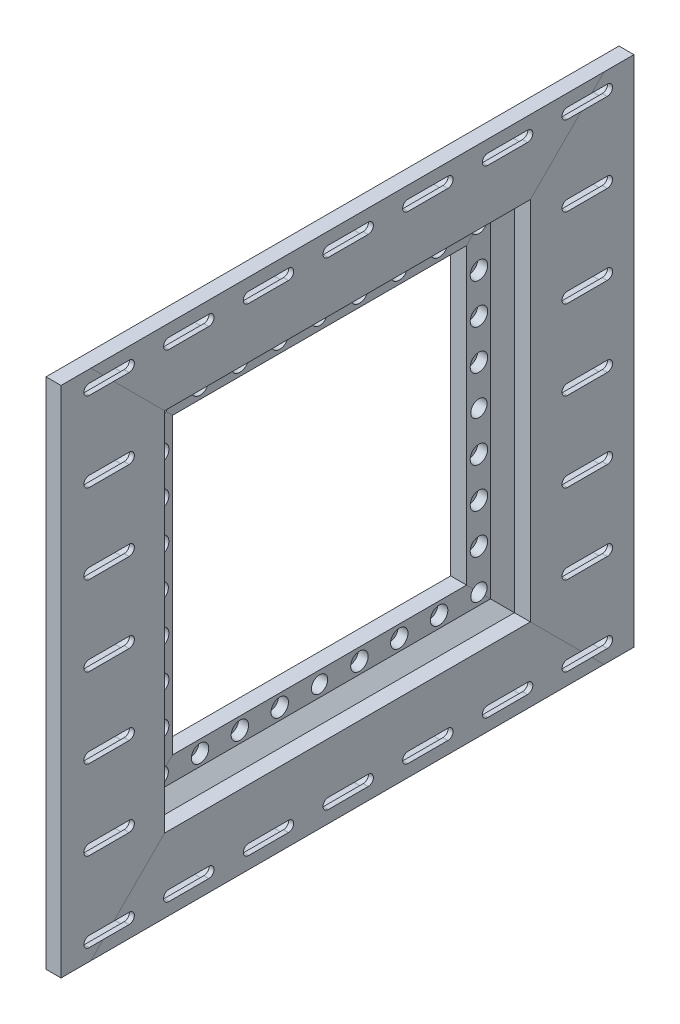
from build123d import *

# Parameters (mm, degrees)
FREE_START                                           = -9.2645
WALL_SCREW_HOLES_R                                   = 3.3782
WALL_SCREW_HOLES_R_2                                 = 5.1945
FREE_FIT_THROUGH_HOLES_DEPTH                         = 10.5345
WALL_SCREWS_CBORE_FOR_1_4_SOCKET_HEAD_CA_D           = 6.7564
WALL_SCREWS_CBORE_FOR_1_4_SOCKET_HEAD_CA_CBORE_D     = 11.1125
WALL_SCREWS_CBORE_FOR_1_4_SOCKET_HEAD_CA_CBORE_DEPTH = 6.35
BOSS_EXTRUDE1_START                                  = 9.525
SKETCH21_W                                           = 19.05
SKETCH21_H                                           = 327.15
BOSS_EXTRUDE1_DEPTH                                  = 9.525
CBORE_START                                          = 9.525
CBORE_SLOT_FOR_1_4_SOCKET_HEAD_CAP_SCREW_DEPTH       = 6.35
CBORE_START_2                                        = 15.875
CBORE_SLOT_FOR_1_4_SOCKET_HEAD_CAP_S_3_DEPTH         = 3.175


# Read off the part's stored shape, not the designer's step: CBORE SLOT for 1/4 Socket Head Cap Screw1
with BuildPart() as part:
    # Frame: sweep along a path in Boundary
    with BuildLine(Plane.ZY) as frame_path:
        Line((0, 0), (-263.65, 0))
        Line((-263.65, 0), (-263.65, 263.65))
        Line((-263.65, 263.65), (0, 263.65))
        Line((0, 263.65), (0, 0))
    # Leg Sketch → Frame (sweep)
    with BuildSketch(Plane.XY):
        Polygon((19.05, 15.24), (8.89, 15.24), (1.27, 22.86), (1.27, 38.1), (-8.89, 38.1), (-8.89, 25.4), (-15.24, 19.05), (-15.24, 15.24), (0, 0), (9.525, 0), (9.525, -31.75), (19.05, -31.75), align=None)
    sweep(path=frame_path.line, transition=Transition.RIGHT)

    # Wall Screw Holes → Free Fit Through Holes (cut)
    with BuildSketch(Plane(origin=(0, 0, 0), x_dir=(0, 0, -1), z_dir=(1, 0, 0)).offset(FREE_START)):
        with Locations(Location((30.23, 55.63, 0), (0, 0, 180))):
            Circle(WALL_SCREW_HOLES_R)
        with Locations(Location((55.63, 30.23, 0), (0, 0, 180))):
            Circle(WALL_SCREW_HOLES_R)
        with Locations(Location((30.23, 81.03, 0), (0, 0, 180))):
            Circle(WALL_SCREW_HOLES_R)
        with Locations(Location((30.23, 106.43, 0), (0, 0, 180))):
            Circle(WALL_SCREW_HOLES_R)
        with Locations(Location((30.23, 157.23, 0), (0, 0, 180))):
            Circle(WALL_SCREW_HOLES_R)
        with Locations(Location((30.23, 182.63, 0), (0, 0, 180))):
            Circle(WALL_SCREW_HOLES_R)
        with Locations(Location((30.23, 208.03, 0), (0, 0, 180))):
            Circle(WALL_SCREW_HOLES_R)
        with Locations(Location((55.63, 233.42, 0), (0, 0, 180))):
            Circle(WALL_SCREW_HOLES_R)
        with Locations(Location((81.03, 233.42, 0), (0, 0, 180))):
            Circle(WALL_SCREW_HOLES_R)
        with Locations(Location((81.03, 30.23, 0), (0, 0, 180))):
            Circle(WALL_SCREW_HOLES_R)
        with Locations(Location((106.43, 233.42, 0), (0, 0, 180))):
            Circle(WALL_SCREW_HOLES_R)
        with Locations(Location((106.43, 30.23, 0), (0, 0, 180))):
            Circle(WALL_SCREW_HOLES_R)
        with Locations(Location((157.23, 233.42, 0), (0, 0, 180))):
            Circle(WALL_SCREW_HOLES_R)
        with Locations(Location((157.23, 30.23, 0), (0, 0, 180))):
            Circle(WALL_SCREW_HOLES_R)
        with Locations(Location((182.63, 233.42, 0), (0, 0, 180))):
            Circle(WALL_SCREW_HOLES_R)
        with Locations(Location((182.63, 30.23, 0), (0, 0, 180))):
            Circle(WALL_SCREW_HOLES_R)
        with Locations(Location((208.03, 233.42, 0), (0, 0, 180))):
            Circle(WALL_SCREW_HOLES_R)
        with Locations(Location((208.03, 30.23, 0), (0, 0, 180))):
            Circle(WALL_SCREW_HOLES_R)
        with Locations(Location((233.42, 81.03, 0), (0, 0, 180))):
            Circle(WALL_SCREW_HOLES_R)
        with Locations(Location((233.42, 55.63, 0), (0, 0, 180))):
            Circle(WALL_SCREW_HOLES_R)
        with Locations(Location((233.42, 106.43, 0), (0, 0, 180))):
            Circle(WALL_SCREW_HOLES_R)
        with Locations(Location((233.42, 157.23, 0), (0, 0, 180))):
            Circle(WALL_SCREW_HOLES_R)
        with Locations(Location((233.42, 182.63, 0), (0, 0, 180))):
            Circle(WALL_SCREW_HOLES_R)
        with Locations(Location((233.42, 208.03, 0), (0, 0, 180))):
            Circle(WALL_SCREW_HOLES_R)
        with Locations(Location((30.23, 233.43, 0), (0, 0, 135.077994507))):
            Circle(WALL_SCREW_HOLES_R_2)
        with Locations(Location((233.42, 233.43, 0), (0, 0, 225.077994507))):
            Circle(WALL_SCREW_HOLES_R_2)
        with Locations(Location((233.42, 30.23, 0), (0, 0, 135))):
            Circle(WALL_SCREW_HOLES_R_2)
        with Locations(Location((30.23, 30.23, 0), (0, 0, 225))):
            Circle(WALL_SCREW_HOLES_R_2)
        with Locations(Location((131.825, 233.42, 0), (0, 0, 180))):
            Circle(WALL_SCREW_HOLES_R_2)
        with Locations(Location((233.42, 131.825, 0), (0, 0, 180))):
            Circle(WALL_SCREW_HOLES_R_2)
        with Locations(Location((131.825, 30.23, 0), (0, 0, 180))):
            Circle(WALL_SCREW_HOLES_R_2)
        with Locations(Location((30.23, 131.825, 0), (0, 0, 180))):
            Circle(WALL_SCREW_HOLES_R_2)
    extrude(amount=FREE_FIT_THROUGH_HOLES_DEPTH, mode=Mode.SUBTRACT)

    # Wall Screws CBORE for 1/4 Socket Head Cap Screw1 (through all)
    with Locations(Plane(origin=(1.27, 208.03, -30.23), x_dir=(0, 0, 1), z_dir=(1, 0, 0))):
        with Locations((0, 0), (0, 25.4), (0, 50.8), (0, 101.6), (0, 127), (0, 152.4), (-25.4, 177.8), (-50.8, 177.8), (-177.8, 177.8), (-152.4, 177.8), (-127, 177.8), (-76.2, 177.8), (-203.19, 152.4), (-203.19, 127), (-203.19, 50.8), (-203.19, 25.4), (-203.19, 0), (-177.8, -25.39), (-152.4, -25.39), (-127, -25.39), (-76.2, -25.39), (-50.8, -25.39), (-25.4, -25.39), (-203.19, 101.6)):
            CounterBoreHole(WALL_SCREWS_CBORE_FOR_1_4_SOCKET_HEAD_CA_D / 2, WALL_SCREWS_CBORE_FOR_1_4_SOCKET_HEAD_CA_CBORE_D / 2, WALL_SCREWS_CBORE_FOR_1_4_SOCKET_HEAD_CA_CBORE_DEPTH)

    # Sketch21 → Boss-Extrude1 (add)
    with BuildSketch(Plane(origin=(0, 0, 0), x_dir=(0, 0, -1), z_dir=(1, 0, 0)).offset(BOSS_EXTRUDE1_START)):
        with Locations((304.925, 131.825)):
            Rectangle(SKETCH21_W, SKETCH21_H)
        with Locations((-41.275, 131.825)):
            Rectangle(SKETCH21_W, SKETCH21_H)
    extrude(amount=BOSS_EXTRUDE1_DEPTH)

    # CBORE SLOT for 1_4 Socket Head Cap S 2 → CBORE SLOT for 1/4 Socket Head Cap Screw1 (cut)
    with BuildSketch(Plane.YZ.offset(CBORE_START)):
        with BuildLine():
            ThreePointArc((238.98125, 32.8), (233.425, 38.35625), (227.86875, 32.8))
            Line((227.86875, 32.8), (227.86875, 7.4))
            ThreePointArc((227.86875, 7.4), (233.425, 1.84375), (238.98125, 7.4))
            Line((238.98125, 7.4), (238.98125, 32.8))
        make_face()
        with BuildLine():
            Line((238.98125, -297.4), (238.98125, -272))
            ThreePointArc((238.98125, -272), (233.425, -266.44375), (227.86875, -272))
            Line((227.86875, -272), (227.86875, -297.4))
            ThreePointArc((227.86875, -297.4), (233.425, -302.95625), (238.98125, -297.4))
        make_face()
        with BuildLine():
            ThreePointArc((188.18125, 32.8), (182.625, 38.35625), (177.06875, 32.8))
            Line((177.06875, 32.8), (177.06875, 7.4))
            ThreePointArc((177.06875, 7.4), (182.625, 1.84375), (188.18125, 7.4))
            Line((188.18125, 7.4), (188.18125, 32.8))
        make_face()
        with BuildLine():
            Line((188.18125, -297.4), (188.18125, -272))
            ThreePointArc((188.18125, -272), (182.625, -266.44375), (177.06875, -272))
            Line((177.06875, -272), (177.06875, -297.4))
            ThreePointArc((177.06875, -297.4), (182.625, -302.95625), (188.18125, -297.4))
        make_face()
        with BuildLine():
            ThreePointArc((137.38125, 32.8), (131.825, 38.35625), (126.26875, 32.8))
            Line((126.26875, 32.8), (126.26875, 7.4))
            ThreePointArc((126.26875, 7.4), (131.825, 1.84375), (137.38125, 7.4))
            Line((137.38125, 7.4), (137.38125, 32.8))
        make_face()
        with BuildLine():
            Line((137.38125, -297.4), (137.38125, -272))
            ThreePointArc((137.38125, -272), (131.825, -266.44375), (126.26875, -272))
            Line((126.26875, -272), (126.26875, -297.4))
            ThreePointArc((126.26875, -297.4), (131.825, -302.95625), (137.38125, -297.4))
        make_face()
        with BuildLine():
            ThreePointArc((86.58125, 32.8), (81.025, 38.35625), (75.46875, 32.8))
            Line((75.46875, 32.8), (75.46875, 7.4))
            ThreePointArc((75.46875, 7.4), (81.025, 1.84375), (86.58125, 7.4))
            Line((86.58125, 7.4), (86.58125, 32.8))
        make_face()
        with BuildLine():
            Line((86.58125, -297.4), (86.58125, -272))
            ThreePointArc((86.58125, -272), (81.025, -266.44375), (75.46875, -272))
            Line((75.46875, -272), (75.46875, -297.4))
            ThreePointArc((75.46875, -297.4), (81.025, -302.95625), (86.58125, -297.4))
        make_face()
        with BuildLine():
            ThreePointArc((35.78125, 32.8), (30.225, 38.35625), (24.66875, 32.8))
            Line((24.66875, 32.8), (24.66875, 7.4))
            ThreePointArc((24.66875, 7.4), (30.225, 1.84375), (35.78125, 7.4))
            Line((35.78125, 7.4), (35.78125, 32.8))
        make_face()
        with BuildLine():
            Line((35.78125, -297.4), (35.78125, -272))
            ThreePointArc((35.78125, -272), (30.225, -266.44375), (24.66875, -272))
            Line((24.66875, -272), (24.66875, -297.4))
            ThreePointArc((24.66875, -297.4), (30.225, -302.95625), (35.78125, -297.4))
        make_face()
        with BuildLine():
            ThreePointArc((-15.01875, 32.8), (-20.575, 38.35625), (-26.13125, 32.8))
            Line((-26.13125, 32.8), (-26.13125, 7.4))
            ThreePointArc((-26.13125, 7.4), (-20.575, 1.84375), (-15.01875, 7.4))
            Line((-15.01875, 7.4), (-15.01875, 32.8))
        make_face()
        with BuildLine():
            Line((-15.01875, -43.4), (-15.01875, -18))
            ThreePointArc((-15.01875, -18), (-20.575, -12.44375), (-26.13125, -18))
            Line((-26.13125, -18), (-26.13125, -43.4))
            ThreePointArc((-26.13125, -43.4), (-20.575, -48.95625), (-15.01875, -43.4))
        make_face()
        with BuildLine():
            Line((-15.01875, -94.2), (-15.01875, -68.8))
            ThreePointArc((-15.01875, -68.8), (-20.575, -63.24375), (-26.13125, -68.8))
            Line((-26.13125, -68.8), (-26.13125, -94.2))
            ThreePointArc((-26.13125, -94.2), (-20.575, -99.75625), (-15.01875, -94.2))
        make_face()
        with BuildLine():
            Line((-15.01875, -145), (-15.01875, -119.6))
            ThreePointArc((-15.01875, -119.6), (-20.575, -114.04375), (-26.13125, -119.6))
            Line((-26.13125, -119.6), (-26.13125, -145))
            ThreePointArc((-26.13125, -145), (-20.575, -150.55625), (-15.01875, -145))
        make_face()
        with BuildLine():
            Line((-15.01875, -195.8), (-15.01875, -170.4))
            ThreePointArc((-15.01875, -170.4), (-20.575, -164.84375), (-26.13125, -170.4))
            Line((-26.13125, -170.4), (-26.13125, -195.8))
            ThreePointArc((-26.13125, -195.8), (-20.575, -201.35625), (-15.01875, -195.8))
        make_face()
        with BuildLine():
            Line((-15.01875, -246.6), (-15.01875, -221.2))
            ThreePointArc((-15.01875, -221.2), (-20.575, -215.64375), (-26.13125, -221.2))
            Line((-26.13125, -221.2), (-26.13125, -246.6))
            ThreePointArc((-26.13125, -246.6), (-20.575, -252.15625), (-15.01875, -246.6))
        make_face()
        with BuildLine():
            Line((-15.01875, -297.4), (-15.01875, -272))
            ThreePointArc((-15.01875, -272), (-20.575, -266.44375), (-26.13125, -272))
            Line((-26.13125, -272), (-26.13125, -297.4))
            ThreePointArc((-26.13125, -297.4), (-20.575, -302.95625), (-15.01875, -297.4))
        make_face()
        with BuildLine():
            ThreePointArc((289.78125, -272), (284.225, -266.44375), (278.66875, -272))
            Line((278.66875, -272), (278.66875, -297.4))
            ThreePointArc((278.66875, -297.4), (284.225, -302.95625), (289.78125, -297.4))
            Line((289.78125, -297.4), (289.78125, -272))
        make_face()
        with BuildLine():
            Line((289.78125, -246.6), (289.78125, -221.2))
            ThreePointArc((289.78125, -221.2), (284.225, -215.64375), (278.66875, -221.2))
            Line((278.66875, -221.2), (278.66875, -246.6))
            ThreePointArc((278.66875, -246.6), (284.225, -252.15625), (289.78125, -246.6))
        make_face()
        with BuildLine():
            Line((289.78125, -195.8), (289.78125, -170.4))
            ThreePointArc((289.78125, -170.4), (284.225, -164.84375), (278.66875, -170.4))
            Line((278.66875, -170.4), (278.66875, -195.8))
            ThreePointArc((278.66875, -195.8), (284.225, -201.35625), (289.78125, -195.8))
        make_face()
        with BuildLine():
            Line((289.78125, -145), (289.78125, -119.6))
            ThreePointArc((289.78125, -119.6), (284.225, -114.04375), (278.66875, -119.6))
            Line((278.66875, -119.6), (278.66875, -145))
            ThreePointArc((278.66875, -145), (284.225, -150.55625), (289.78125, -145))
        make_face()
        with BuildLine():
            Line((289.78125, -94.2), (289.78125, -68.8))
            ThreePointArc((289.78125, -68.8), (284.225, -63.24375), (278.66875, -68.8))
            Line((278.66875, -68.8), (278.66875, -94.2))
            ThreePointArc((278.66875, -94.2), (284.225, -99.75625), (289.78125, -94.2))
        make_face()
        with BuildLine():
            Line((289.78125, -43.4), (289.78125, -18))
            ThreePointArc((289.78125, -18), (284.225, -12.44375), (278.66875, -18))
            Line((278.66875, -18), (278.66875, -43.4))
            ThreePointArc((278.66875, -43.4), (284.225, -48.95625), (289.78125, -43.4))
        make_face()
        with BuildLine():
            Line((289.78125, 7.4), (289.78125, 32.8))
            ThreePointArc((289.78125, 32.8), (284.225, 38.35625), (278.66875, 32.8))
            Line((278.66875, 32.8), (278.66875, 7.4))
            ThreePointArc((278.66875, 7.4), (284.225, 1.84375), (289.78125, 7.4))
        make_face()
    extrude(amount=CBORE_SLOT_FOR_1_4_SOCKET_HEAD_CAP_SCREW_DEPTH, mode=Mode.SUBTRACT)

    # CBORE SLOT for 1_4 Socket Head Cap S 3 o → CBORE SLOT for 1_4 Socket Head Cap S 3 (cut)
    with BuildSketch(Plane.YZ.offset(CBORE_START_2)):
        with BuildLine():
            ThreePointArc((236.8032, 32.8), (233.425, 36.1782), (230.0468, 32.8))
            Line((230.0468, 32.8), (230.0468, 7.4))
            ThreePointArc((230.0468, 7.4), (233.425, 4.0218), (236.8032, 7.4))
            Line((236.8032, 7.4), (236.8032, 32.8))
        make_face()
        with BuildLine():
            Line((236.8032, -297.4), (236.8032, -272))
            ThreePointArc((236.8032, -272), (233.425, -268.6218), (230.0468, -272))
            Line((230.0468, -272), (230.0468, -297.4))
            ThreePointArc((230.0468, -297.4), (233.425, -300.7782), (236.8032, -297.4))
        make_face()
        with BuildLine():
            ThreePointArc((186.0032, 32.8), (182.625, 36.1782), (179.2468, 32.8))
            Line((179.2468, 32.8), (179.2468, 7.4))
            ThreePointArc((179.2468, 7.4), (182.625, 4.0218), (186.0032, 7.4))
            Line((186.0032, 7.4), (186.0032, 32.8))
        make_face()
        with BuildLine():
            Line((186.0032, -297.4), (186.0032, -272))
            ThreePointArc((186.0032, -272), (182.625, -268.6218), (179.2468, -272))
            Line((179.2468, -272), (179.2468, -297.4))
            ThreePointArc((179.2468, -297.4), (182.625, -300.7782), (186.0032, -297.4))
        make_face()
        with BuildLine():
            ThreePointArc((135.2032, 32.8), (131.825, 36.1782), (128.4468, 32.8))
            Line((128.4468, 32.8), (128.4468, 7.4))
            ThreePointArc((128.4468, 7.4), (131.825, 4.0218), (135.2032, 7.4))
            Line((135.2032, 7.4), (135.2032, 32.8))
        make_face()
        with BuildLine():
            Line((135.2032, -297.4), (135.2032, -272))
            ThreePointArc((135.2032, -272), (131.825, -268.6218), (128.4468, -272))
            Line((128.4468, -272), (128.4468, -297.4))
            ThreePointArc((128.4468, -297.4), (131.825, -300.7782), (135.2032, -297.4))
        make_face()
        with BuildLine():
            ThreePointArc((84.4032, 32.8), (81.025, 36.1782), (77.6468, 32.8))
            Line((77.6468, 32.8), (77.6468, 7.4))
            ThreePointArc((77.6468, 7.4), (81.025, 4.0218), (84.4032, 7.4))
            Line((84.4032, 7.4), (84.4032, 32.8))
        make_face()
        with BuildLine():
            Line((84.4032, -297.4), (84.4032, -272))
            ThreePointArc((84.4032, -272), (81.025, -268.6218), (77.6468, -272))
            Line((77.6468, -272), (77.6468, -297.4))
            ThreePointArc((77.6468, -297.4), (81.025, -300.7782), (84.4032, -297.4))
        make_face()
        with BuildLine():
            ThreePointArc((33.6032, 32.8), (30.225, 36.1782), (26.8468, 32.8))
            Line((26.8468, 32.8), (26.8468, 7.4))
            ThreePointArc((26.8468, 7.4), (30.225, 4.0218), (33.6032, 7.4))
            Line((33.6032, 7.4), (33.6032, 32.8))
        make_face()
        with BuildLine():
            Line((33.6032, -297.4), (33.6032, -272))
            ThreePointArc((33.6032, -272), (30.225, -268.6218), (26.8468, -272))
            Line((26.8468, -272), (26.8468, -297.4))
            ThreePointArc((26.8468, -297.4), (30.225, -300.7782), (33.6032, -297.4))
        make_face()
        with BuildLine():
            ThreePointArc((-17.1968, 32.8), (-20.575, 36.1782), (-23.9532, 32.8))
            Line((-23.9532, 32.8), (-23.9532, 7.4))
            ThreePointArc((-23.9532, 7.4), (-20.575, 4.0218), (-17.1968, 7.4))
            Line((-17.1968, 7.4), (-17.1968, 32.8))
        make_face()
        with BuildLine():
            Line((-17.1968, -43.4), (-17.1968, -18))
            ThreePointArc((-17.1968, -18), (-20.575, -14.6218), (-23.9532, -18))
            Line((-23.9532, -18), (-23.9532, -43.4))
            ThreePointArc((-23.9532, -43.4), (-20.575, -46.7782), (-17.1968, -43.4))
        make_face()
        with BuildLine():
            Line((-17.1968, -94.2), (-17.1968, -68.8))
            ThreePointArc((-17.1968, -68.8), (-20.575, -65.4218), (-23.9532, -68.8))
            Line((-23.9532, -68.8), (-23.9532, -94.2))
            ThreePointArc((-23.9532, -94.2), (-20.575, -97.5782), (-17.1968, -94.2))
        make_face()
        with BuildLine():
            Line((-17.1968, -145), (-17.1968, -119.6))
            ThreePointArc((-17.1968, -119.6), (-20.575, -116.2218), (-23.9532, -119.6))
            Line((-23.9532, -119.6), (-23.9532, -145))
            ThreePointArc((-23.9532, -145), (-20.575, -148.3782), (-17.1968, -145))
        make_face()
        with BuildLine():
            Line((-17.1968, -195.8), (-17.1968, -170.4))
            ThreePointArc((-17.1968, -170.4), (-20.575, -167.0218), (-23.9532, -170.4))
            Line((-23.9532, -170.4), (-23.9532, -195.8))
            ThreePointArc((-23.9532, -195.8), (-20.575, -199.1782), (-17.1968, -195.8))
        make_face()
        with BuildLine():
            Line((-17.1968, -246.6), (-17.1968, -221.2))
            ThreePointArc((-17.1968, -221.2), (-20.575, -217.8218), (-23.9532, -221.2))
            Line((-23.9532, -221.2), (-23.9532, -246.6))
            ThreePointArc((-23.9532, -246.6), (-20.575, -249.9782), (-17.1968, -246.6))
        make_face()
        with BuildLine():
            Line((-17.1968, -297.4), (-17.1968, -272))
            ThreePointArc((-17.1968, -272), (-20.575, -268.6218), (-23.9532, -272))
            Line((-23.9532, -272), (-23.9532, -297.4))
            ThreePointArc((-23.9532, -297.4), (-20.575, -300.7782), (-17.1968, -297.4))
        make_face()
        with BuildLine():
            ThreePointArc((287.6032, -272), (284.225, -268.6218), (280.8468, -272))
            Line((280.8468, -272), (280.8468, -297.4))
            ThreePointArc((280.8468, -297.4), (284.225, -300.7782), (287.6032, -297.4))
            Line((287.6032, -297.4), (287.6032, -272))
        make_face()
        with BuildLine():
            Line((287.6032, -246.6), (287.6032, -221.2))
            ThreePointArc((287.6032, -221.2), (284.225, -217.8218), (280.8468, -221.2))
            Line((280.8468, -221.2), (280.8468, -246.6))
            ThreePointArc((280.8468, -246.6), (284.225, -249.9782), (287.6032, -246.6))
        make_face()
        with BuildLine():
            Line((287.6032, -195.8), (287.6032, -170.4))
            ThreePointArc((287.6032, -170.4), (284.225, -167.0218), (280.8468, -170.4))
            Line((280.8468, -170.4), (280.8468, -195.8))
            ThreePointArc((280.8468, -195.8), (284.225, -199.1782), (287.6032, -195.8))
        make_face()
        with BuildLine():
            Line((287.6032, -145), (287.6032, -119.6))
            ThreePointArc((287.6032, -119.6), (284.225, -116.2218), (280.8468, -119.6))
            Line((280.8468, -119.6), (280.8468, -145))
            ThreePointArc((280.8468, -145), (284.225, -148.3782), (287.6032, -145))
        make_face()
        with BuildLine():
            Line((287.6032, -94.2), (287.6032, -68.8))
            ThreePointArc((287.6032, -68.8), (284.225, -65.4218), (280.8468, -68.8))
            Line((280.8468, -68.8), (280.8468, -94.2))
            ThreePointArc((280.8468, -94.2), (284.225, -97.5782), (287.6032, -94.2))
        make_face()
        with BuildLine():
            Line((287.6032, -43.4), (287.6032, -18))
            ThreePointArc((287.6032, -18), (284.225, -14.6218), (280.8468, -18))
            Line((280.8468, -18), (280.8468, -43.4))
            ThreePointArc((280.8468, -43.4), (284.225, -46.7782), (287.6032, -43.4))
        make_face()
        with BuildLine():
            Line((287.6032, 7.4), (287.6032, 32.8))
            ThreePointArc((287.6032, 32.8), (284.225, 36.1782), (280.8468, 32.8))
            Line((280.8468, 32.8), (280.8468, 7.4))
            ThreePointArc((280.8468, 7.4), (284.225, 4.0218), (287.6032, 7.4))
        make_face()
    extrude(amount=CBORE_SLOT_FOR_1_4_SOCKET_HEAD_CAP_S_3_DEPTH, mode=Mode.SUBTRACT)


solid = part.part
